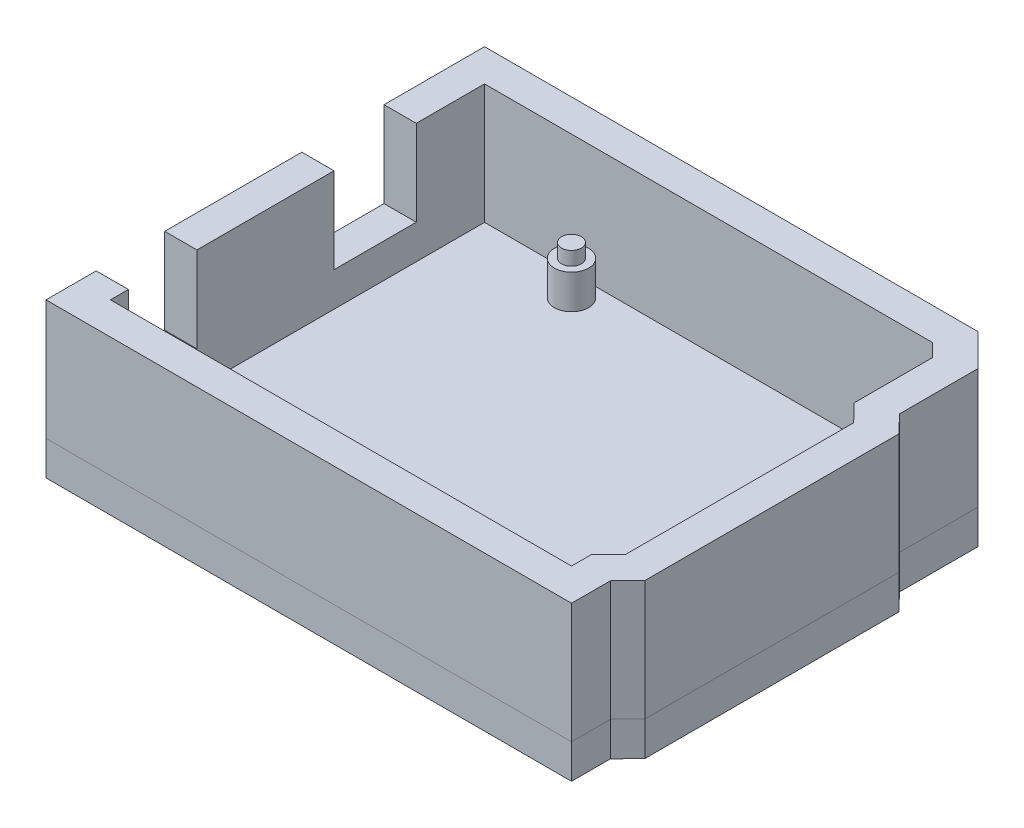
from build123d import *

# Parameters (mm, degrees)
SKETCH2_R           = 1.5875
BOSS_EXTRUDE1_DEPTH = 5
BOSS_EXTRUDE3_DEPTH = 10
SKETCH5_W           = 4.7
SKETCH5_H           = 10
SKETCH5_H_2         = 12
CUT_EXTRUDE1_DEPTH  = 5
SKETCH8_W           = 4.7
SKETCH8_H           = 20
BOSS_EXTRUDE4_DEPTH = 7.5
SKETCH9_R           = 2.5
BOSS_EXTRUDE5_DEPTH = 5
SKETCH10_R          = 1.44
SKETCH10_R_2        = 1.425
BOSS_EXTRUDE6_DEPTH = 2


with BuildPart() as part:
    # Sketch2 → Boss-Extrude1 (new body)
    with BuildSketch(Plane(origin=(0, 0, 0), x_dir=(1, 0, 0), z_dir=(0, 1, 0))):
        Polygon((13.220192639, 43.095561972), (-58.780349242, 43.095561972), (-58.780349242, -20.882908028), (17.889650758, -20.882908028), (17.889650758, -15.201225268), (20.369650758, -12.661225268), (20.369650758, 24.421409213), (17.889650758, 26.961409213), (17.889650758, 38.426103853), align=None)
        with Locations((-39.510349242, -13.042908028)):
            Circle(SKETCH2_R, mode=Mode.SUBTRACT)
        with Locations((12.589650758, -7.962908028)):
            Circle(SKETCH2_R, mode=Mode.SUBTRACT)
        with Locations((-38.210349242, 35.217091972)):
            Circle(SKETCH2_R, mode=Mode.SUBTRACT)
        with Locations((12.557854383, 19.965306842)):
            Circle(SKETCH2_R, mode=Mode.SUBTRACT)
    extrude(amount=BOSS_EXTRUDE1_DEPTH)

    # Sketch4 → Boss-Extrude3 (add)
    with BuildSketch(Plane(origin=(0, 5, 0), x_dir=(1, 0, 0), z_dir=(0, 1, 0))):
        Polygon((-58.781454962, 43.099007319), (13.219086919, 43.099007319), (17.888545038, 38.4295492), (17.888545038, 26.96485456), (20.368545038, 24.42485456), (20.368545038, -12.657779921), (17.888545038, -15.197779921), (17.888545038, -20.879462681), (-58.781454962, -20.879462681), align=None)
        Polygon((-54.081454962, 38.399007319), (11.272283176, 38.399007319), (13.188545038, 36.482745457), (13.188545038, 25.05087512), (15.668545038, 22.51087512), (15.668545038, -10.743800481), (13.188545038, -13.283800481), (13.188545038, -16.179462681), (-54.081454962, -16.179462681), align=None, mode=Mode.SUBTRACT)
    extrude(amount=BOSS_EXTRUDE3_DEPTH)

    # Sketch5 → Cut-Extrude1 (cut)
    with BuildSketch(Plane(origin=(0, 15, 0), x_dir=(1, 0, 0), z_dir=(0, 1, 0))):
        with Locations((-56.431454962, -8.560992681)):
            Rectangle(SKETCH5_W, SKETCH5_H)
        with Locations((-56.431454962, 22.439007319)):
            Rectangle(SKETCH5_W, SKETCH5_H_2)
    extrude(amount=-CUT_EXTRUDE1_DEPTH, mode=Mode.SUBTRACT)

    # Sketch8 → Boss-Extrude4 (add)
    with BuildSketch(Plane(origin=(0, 15, 0), x_dir=(1, 0, 0), z_dir=(0, 1, 0))):
        Polygon((-58.781454962, 28.439007319), (-54.081454962, 28.439007319), (-54.081454962, 38.399007319), (11.272283176, 38.399007319), (13.188545038, 36.482745457), (13.188545038, 25.05087512), (15.668545038, 22.51087512), (15.668545038, -10.743800481), (13.188545038, -13.283800481), (13.188545038, -16.179462681), (-54.081454962, -16.179462681), (-54.081454962, -13.560992681), (-58.781454962, -13.560992681), (-58.781454962, -20.879462681), (17.888545038, -20.879462681), (17.888545038, -15.197779921), (20.368545038, -12.657779921), (20.368545038, 24.42485456), (17.888545038, 26.96485456), (17.888545038, 38.4295492), (13.219086919, 43.099007319), (-58.781454962, 43.099007319), align=None)
        with Locations((-56.431454962, 6.439007319)):
            Rectangle(SKETCH8_W, SKETCH8_H)
    extrude(amount=BOSS_EXTRUDE4_DEPTH)

    # Sketch9 → Boss-Extrude5 (add)
    with BuildSketch(Plane(origin=(0, 5, 0), x_dir=(1, 0, 0), z_dir=(0, 1, 0))):
        with Locations((-38.210349242, 35.217091972)):
            Circle(SKETCH9_R)
        with Locations((12.557854383, 19.965306842)):
            Circle(SKETCH9_R)
        with Locations((12.589650758, -7.962908028)):
            Circle(SKETCH9_R)
        with Locations((-39.510349242, -13.042908028)):
            Circle(SKETCH9_R)
    extrude(amount=BOSS_EXTRUDE5_DEPTH)

    # Sketch10 → Boss-Extrude6 (add)
    with BuildSketch(Plane(origin=(0, 10, 0), x_dir=(1, 0, 0), z_dir=(0, 1, 0))):
        with Locations((-38.210349242, 35.217091972)):
            Circle(SKETCH10_R)
        with Locations((12.557854383, 19.965306842)):
            Circle(SKETCH10_R_2)
        with Locations((12.589650758, -7.962908028)):
            Circle(SKETCH10_R_2)
        with Locations((-39.510349242, -13.042908028)):
            Circle(SKETCH10_R_2)
    extrude(amount=BOSS_EXTRUDE6_DEPTH)


solid = part.part
